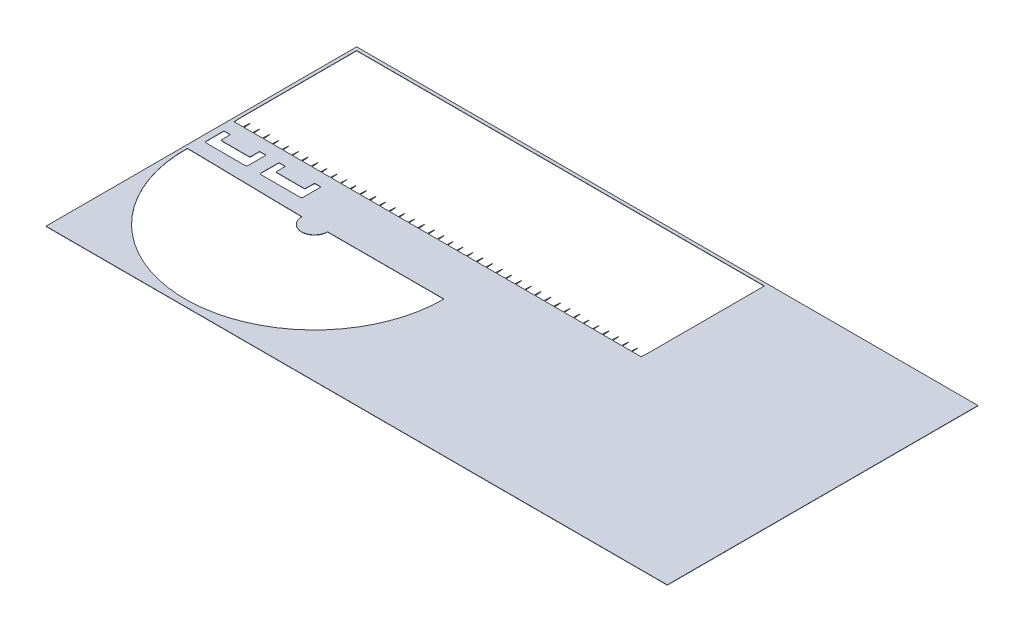
from build123d import *

# Parameters (mm, degrees)
SKETCH1_W          = 2438.4
SKETCH1_H          = 1219.2
BASE_FLANGE1_DEPTH = 1.02362
CUT_EXTRUDE1_DEPTH = 1364.107423426


# Sheet-metal steps are written as plain solids
with BuildPart() as part:
    # Sketch1 → Base-Flange1 (new body)
    with BuildSketch(Plane(origin=(0, 0, 0), x_dir=(1, 0, 0), z_dir=(0, 1, 0))):
        Rectangle(SKETCH1_W, SKETCH1_H)
    extrude(amount=-BASE_FLANGE1_DEPTH)

    # Sketch6 → Cut-Extrude1 (cut, through all)
    with BuildSketch(Plane(origin=(0, 0, 0), x_dir=(1, 0, 0), z_dir=(0, 1, 0))):
        Polygon((-1206.5, 596.9), (393.7, 596.9), (393.7, 139.7), (391.8839, 114.3), (357.4161, 114.3), (355.6, 139.7), (353.7839, 114.3), (319.3161, 114.3), (317.5, 139.7), (315.6839, 114.3), (281.2161, 114.3), (279.4, 139.7), (277.5839, 114.3), (243.1161, 114.3), (241.3, 139.7), (239.4839, 114.3), (205.0161, 114.3), (203.2, 139.7), (201.3839, 114.3), (166.9161, 114.3), (165.1, 139.7), (163.2839, 114.3), (128.8161, 114.3), (127, 139.7), (125.1839, 114.3), (90.7161, 114.3), (88.9, 139.7), (87.0839, 114.3), (52.6161, 114.3), (50.8, 139.7), (48.9839, 114.3), (14.5161, 114.3), (12.7, 139.7), (10.8839, 114.3), (-23.5839, 114.3), (-25.4, 139.7), (-27.2161, 114.3), (-61.6839, 114.3), (-63.5, 139.7), (-65.3161, 114.3), (-99.7839, 114.3), (-101.6, 139.7), (-103.4161, 114.3), (-137.8839, 114.3), (-139.7, 139.7), (-141.5161, 114.3), (-175.9839, 114.3), (-177.8, 139.7), (-179.6161, 114.3), (-214.0839, 114.3), (-215.9, 139.7), (-217.7161, 114.3), (-252.1839, 114.3), (-254, 139.7), (-255.8161, 114.3), (-290.2839, 114.3), (-292.1, 139.7), (-293.9161, 114.3), (-328.3839, 114.3), (-330.2, 139.7), (-332.0161, 114.3), (-366.4839, 114.3), (-368.3, 139.7), (-370.1161, 114.3), (-404.5839, 114.3), (-406.4, 139.7), (-408.2161, 114.3), (-442.6839, 114.3), (-444.5, 139.7), (-446.3161, 114.3), (-480.7839, 114.3), (-482.6, 139.7), (-484.4161, 114.3), (-518.8839, 114.3), (-520.7, 139.7), (-522.5161, 114.3), (-556.9839, 114.3), (-558.8, 139.7), (-560.6161, 114.3), (-595.0839, 114.3), (-596.9, 139.7), (-598.7161, 114.3), (-633.1839, 114.3), (-635, 139.7), (-636.8161, 114.3), (-671.2839, 114.3), (-673.1, 139.7), (-674.9161, 114.3), (-709.3839, 114.3), (-711.2, 139.7), (-713.0161, 114.3), (-747.4839, 114.3), (-749.3, 139.7), (-751.1161, 114.3), (-785.5839, 114.3), (-787.4, 139.7), (-789.2161, 114.3), (-823.6839, 114.3), (-825.5, 139.7), (-827.3161, 114.3), (-861.7839, 114.3), (-863.6, 139.7), (-865.4161, 114.3), (-899.8839, 114.3), (-901.7, 139.7), (-903.5161, 114.3), (-937.9839, 114.3), (-939.8, 139.7), (-941.6161, 114.3), (-976.0839, 114.3), (-977.9, 139.7), (-979.7161, 114.3), (-1014.1839, 114.3), (-1016, 139.7), (-1017.8161, 114.3), (-1052.2839, 114.3), (-1054.1, 139.7), (-1055.9161, 114.3), (-1090.3839, 114.3), (-1092.2, 139.7), (-1094.0161, 114.3), (-1128.4839, 114.3), (-1130.3, 139.7), (-1132.1161, 114.3), (-1166.5839, 114.3), (-1168.4, 139.7), (-1170.2161, 114.3), (-1204.6839, 114.3), (-1206.5, 139.7), align=None)
        with BuildLine():
            Line((-647.7, -76.2), (-190.5, -76.2))
            ThreePointArc((-190.5, -76.2), (-702.933080033, -584.180656917), (-1206.422629139, -67.33417753))
            Line((-1206.422629139, -67.33417753), (-749.292262914, -75.313417753))
            ThreePointArc((-749.292262914, -75.313417753), (-698.943308003, -126.998065692), (-647.7, -76.2))
        make_face()
        with BuildLine():
            Line((-1111.25, -12.7), (-1187.45, -12.7))
            ThreePointArc((-1187.45, -12.7), (-1191.940128061, -10.840128061), (-1193.8, -6.35))
            Line((-1193.8, -6.35), (-1193.8, 60.325))
            ThreePointArc((-1193.8, 60.325), (-1192.87006403, 62.57006403), (-1190.625, 63.5))
            Line((-1190.625, 63.5), (-1171.575, 63.5))
            ThreePointArc((-1171.575, 63.5), (-1169.32993597, 62.57006403), (-1168.4, 60.325))
            Line((-1168.4, 60.325), (-1168.4, 28.575))
            ThreePointArc((-1168.4, 28.575), (-1167.47006403, 26.32993597), (-1165.225, 25.4))
            Line((-1165.225, 25.4), (-1057.275, 25.4))
            ThreePointArc((-1057.275, 25.4), (-1055.02993597, 26.32993597), (-1054.1, 28.575))
            Line((-1054.1, 28.575), (-1054.1, 60.325))
            ThreePointArc((-1054.1, 60.325), (-1053.17006403, 62.57006403), (-1050.925, 63.5))
            Line((-1050.925, 63.5), (-1031.875, 63.5))
            ThreePointArc((-1031.875, 63.5), (-1029.62993597, 62.57006403), (-1028.7, 60.325))
            Line((-1028.7, 60.325), (-1028.7, -6.35))
            ThreePointArc((-1028.7, -6.35), (-1030.559871939, -10.840128061), (-1035.05, -12.7))
            Line((-1035.05, -12.7), (-1111.25, -12.7))
        make_face()
        with BuildLine():
            Line((-895.35, -12.7), (-971.55, -12.7))
            ThreePointArc((-971.55, -12.7), (-976.040128061, -10.840128061), (-977.9, -6.35))
            Line((-977.9, -6.35), (-977.9, 60.325))
            ThreePointArc((-977.9, 60.325), (-976.97006403, 62.57006403), (-974.725, 63.5))
            Line((-974.725, 63.5), (-955.675, 63.5))
            ThreePointArc((-955.675, 63.5), (-953.42993597, 62.57006403), (-952.5, 60.325))
            Line((-952.5, 60.325), (-952.5, 28.575))
            ThreePointArc((-952.5, 28.575), (-951.57006403, 26.32993597), (-949.325, 25.4))
            Line((-949.325, 25.4), (-841.375, 25.4))
            ThreePointArc((-841.375, 25.4), (-839.12993597, 26.32993597), (-838.2, 28.575))
            Line((-838.2, 28.575), (-838.2, 60.325))
            ThreePointArc((-838.2, 60.325), (-837.27006403, 62.57006403), (-835.025, 63.5))
            Line((-835.025, 63.5), (-815.975, 63.5))
            ThreePointArc((-815.975, 63.5), (-813.72993597, 62.57006403), (-812.8, 60.325))
            Line((-812.8, 60.325), (-812.8, -6.35))
            ThreePointArc((-812.8, -6.35), (-814.659871939, -10.840128061), (-819.15, -12.7))
            Line((-819.15, -12.7), (-895.35, -12.7))
        make_face()
    extrude(amount=-CUT_EXTRUDE1_DEPTH, mode=Mode.SUBTRACT)


solid = part.part
